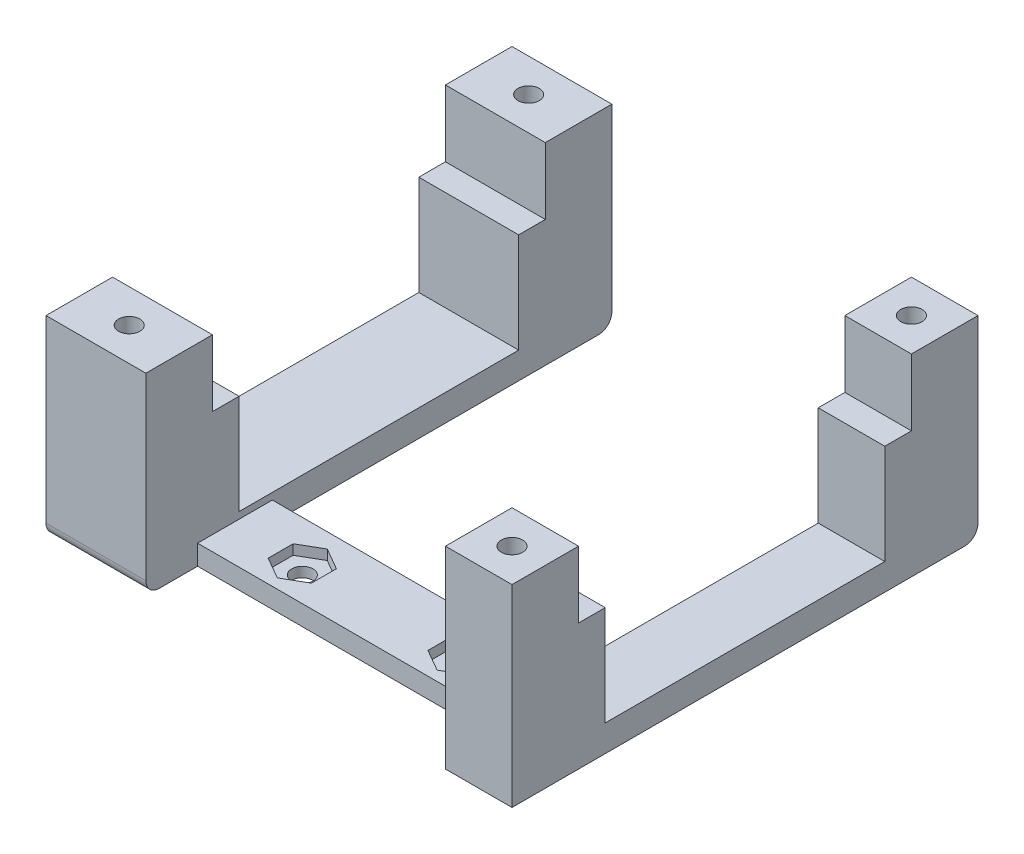
from build123d import *
from build123d.topology import SkipClean

# Parameters (mm, degrees)
CROQUIS1_W                = 15
CROQUIS1_H                = 10
CROQUIS1_R                = 1.6
SALIENTE_EXTRUIR2_DEPTH   = 25
SALIENTE_EXTRUIR2_2_DEPTH = 25
CROQUIS1_W_2              = 10
SALIENTE_EXTRUIR2_3_DEPTH = 25
SALIENTE_EXTRUIR2_4_DEPTH = 25
SALIENTE_EXTRUIR3_START   = 4
CROQUIS2_R                = 1.6
CROQUIS2_W                = 15
CROQUIS2_H                = 10
SALIENTE_EXTRUIR3_DEPTH   = 4
CROQUIS3_W                = 15
CROQUIS3_H                = 4
CROQUIS3_W_2              = 10
SALIENTE_EXTRUIR4_DEPTH   = 15
CROQUIS4_R                = 3.5
CORTAR_EXTRUIR1_DEPTH     = 3.5
SALIENTE_EXTRUIR5_DEPTH   = 3
CROQUIS6_R                = 1.6
CORTAR_EXTRUIR2_DEPTH     = 3
CORTAR_EXTRUIR3_DEPTH     = 1.5
REDONDEO1_R               = 2


with BuildPart() as part:
    # Croquis1 → Saliente-Extruir2 (new body)
    with BuildSketch(Plane(origin=(0, 0, 0), x_dir=(1, 0, 0), z_dir=(0, 1, 0))):
        with Locations((-17.954545455, 17.15034965)):
            Rectangle(CROQUIS1_W, CROQUIS1_H)
        with Locations(Location((-17.954545455, 17.15034965, 0), (0, 0, 270))):
            Circle(CROQUIS1_R, mode=Mode.SUBTRACT)
    extrude(amount=SALIENTE_EXTRUIR2_DEPTH)



with BuildPart() as body_2:
    # Croquis1 → Saliente-Extruir2 2 (new body)
    with BuildSketch(Plane(origin=(0, 0, 0), x_dir=(1, 0, 0), z_dir=(0, 1, 0))):
        with Locations((-17.954545455, -42.84965035)):
            Rectangle(CROQUIS1_W, CROQUIS1_H)
        with Locations(Location((-17.954545455, -42.84965035, 0), (0, 0, 270))):
            Circle(CROQUIS1_R, mode=Mode.SUBTRACT)
    extrude(amount=SALIENTE_EXTRUIR2_2_DEPTH)


with BuildPart() as body_3:
    # Croquis1 → Saliente-Extruir2 3 (new body)
    with BuildSketch(Plane(origin=(0, 0, 0), x_dir=(1, 0, 0), z_dir=(0, 1, 0))):
        with Locations((39.545454545, -42.84965035)):
            Rectangle(CROQUIS1_W_2, CROQUIS1_H)
        with Locations(Location((39.545454545, -42.84965035, 0), (0, 0, 270))):
            Circle(CROQUIS1_R, mode=Mode.SUBTRACT)
    extrude(amount=SALIENTE_EXTRUIR2_3_DEPTH)


with BuildPart() as body_4:
    # Croquis1 → Saliente-Extruir2 4 (new body)
    with BuildSketch(Plane(origin=(0, 0, 0), x_dir=(1, 0, 0), z_dir=(0, 1, 0))):
        with Locations((39.545454545, 17.15034965)):
            Rectangle(CROQUIS1_W_2, CROQUIS1_H)
        with Locations(Location((39.545454545, 17.15034965, 0), (0, 0, 270))):
            Circle(CROQUIS1_R, mode=Mode.SUBTRACT)
    extrude(amount=SALIENTE_EXTRUIR2_4_DEPTH)


with BuildPart() as part_1:
    with SkipClean():  # the faces are left unmerged after this step: merging them gives an invalid solid
        add(part.part)

        add(body_2.part)  # Saliente-Extruir3 merges body 2

        add(body_3.part)  # Saliente-Extruir3 merges body 3

        add(body_4.part)  # Saliente-Extruir3 merges body 4
        # Croquis2 → Saliente-Extruir3 (add)
        # profile 1 of 3: a face of its own
        with BuildSketch(Plane.XZ.offset(SALIENTE_EXTRUIR3_START)):
            Polygon((-25.454545455, -22.15034965), (-10.454545455, -22.15034965), (-10.454545455, -12.15034965), (-10.454545455, 37.84965035), (-25.454545455, 37.84965035), (-25.454545455, -12.15034965), align=None)
            with Locations(Location((-17.954545455, -17.15034965, 0), (0, 0, 270))):
                Circle(CROQUIS2_R, mode=Mode.SUBTRACT)
        # profile 2 of 3: a face of its own
        with BuildSketch(Plane.XZ.offset(SALIENTE_EXTRUIR3_START)):
            with Locations((-17.954545455, 42.84965035)):
                Rectangle(CROQUIS2_W, CROQUIS2_H)
            with Locations(Location((-17.954545455, 42.84965035, 0), (0, 0, 90))):
                Circle(CROQUIS2_R, mode=Mode.SUBTRACT)
        # profile 3 of 3: a face of its own
        with BuildSketch(Plane.XZ.offset(SALIENTE_EXTRUIR3_START)):
            Polygon((34.545454545, -12.15034965), (34.545454545, -22.15034965), (44.545454545, -22.15034965), (44.545454545, -12.15034965), (44.545454545, 37.84965035), (44.545454545, 47.84965035), (34.545454545, 47.84965035), (34.545454545, 37.84965035), align=None)
            with Locations(Location((39.545454545, -17.15034965, 0), (0, 0, 90))):
                Circle(CROQUIS2_R, mode=Mode.SUBTRACT)
            with Locations(Location((39.545454545, 42.84965035, 0), (0, 0, 270))):
                Circle(CROQUIS2_R, mode=Mode.SUBTRACT)
        extrude(amount=-SALIENTE_EXTRUIR3_DEPTH)

    # Croquis3 → Saliente-Extruir4 (add)
    with BuildSketch(Plane(origin=(0, 0, 0), x_dir=(1, 0, 0), z_dir=(0, 1, 0))):
        with Locations((-17.954545455, -35.84965035)):
            Rectangle(CROQUIS3_W, CROQUIS3_H)
        with Locations((-17.954545455, 10.15034965)):
            Rectangle(CROQUIS3_W, CROQUIS3_H)
        with Locations((39.545454545, 10.15034965)):
            Rectangle(CROQUIS3_W_2, CROQUIS3_H)
        with Locations((39.545454545, -35.84965035)):
            Rectangle(CROQUIS3_W_2, CROQUIS3_H)
    extrude(amount=SALIENTE_EXTRUIR4_DEPTH)

    # Croquis4 → Cortar-Extruir1 (cut)
    with SkipClean():  # the faces are left unmerged after this step: merging them gives an invalid solid
        with BuildSketch(Plane.XZ.offset(4)):
            with Locations(Location((39.545454545, 42.84965035, 0), (0, 0, 270))):
                Circle(CROQUIS4_R)
            with Locations(Location((39.545454545, -17.15034965, 0), (0, 0, 270))):
                Circle(CROQUIS4_R)
            with Locations(Location((-17.954545455, -17.15034965, 0), (0, 0, 270))):
                Circle(CROQUIS4_R)
            with Locations(Location((-17.954545455, 42.84965035, 0), (0, 0, 270))):
                Circle(CROQUIS4_R)
        extrude(amount=-CORTAR_EXTRUIR1_DEPTH, mode=Mode.SUBTRACT)

    # Croquis5 → Saliente-Extruir5 (add)
    with SkipClean():  # the faces are left unmerged after this step: merging them gives an invalid solid
        with BuildSketch(Plane.XZ.offset(4)):
            Polygon((-10.454545455, 40.07981816), (34.545454545, 40.07981816), (34.545454545, 35.84965035), (34.545454545, 28.84965035), (-10.454545455, 28.84965035), (-10.454545455, 35.84965035), align=None)
        extrude(amount=-SALIENTE_EXTRUIR5_DEPTH)

    # Croquis6 → Cortar-Extruir2 (cut)
    with SkipClean():  # the faces are left unmerged after this step: merging them gives an invalid solid
        with BuildSketch(Plane.XZ.offset(4)):
            with Locations(Location((24.045454545, 34.84965035, 0), (0, 0, 270))):
                Circle(CROQUIS6_R)
            with Locations(Location((0.045454545, 34.84965035, 0), (0, 0, 270))):
                Circle(CROQUIS6_R)
        extrude(amount=-CORTAR_EXTRUIR2_DEPTH, mode=Mode.SUBTRACT)

    # Croquis7 → Cortar-Extruir3 (cut)
    with SkipClean():  # the faces are left unmerged after this step: merging them gives an invalid solid
        with BuildSketch(Plane(origin=(0, -1, 0), x_dir=(1, 0, 0), z_dir=(0, 1, 0))):
            Polygon((0.045454545, -31.0968736), (-3.204545455, -32.973261975), (-3.204545455, -36.726038725), (0.045454545, -38.602427099), (3.295454545, -36.726038725), (3.295454545, -32.973261975), align=None)
            Polygon((24.045454545, -31.0968736), (20.795454545, -32.973261975), (20.795454545, -36.726038725), (24.045454545, -38.602427099), (27.295454545, -36.726038725), (27.295454545, -32.973261975), align=None)
        extrude(amount=-CORTAR_EXTRUIR3_DEPTH, mode=Mode.SUBTRACT)

    # Redondeo1
    # the kernel refuses this fillet: 2 mm, written as the material it takes off along each edge
    with BuildSketch(Plane(origin=(-5.454545455, -4, 47.84965035), x_dir=(0, 0, -1), z_dir=(-1, 0, 0)), Plane(origin=(-30.454545455, -4, -22.15034965), x_dir=(0, 0, 1), z_dir=(1, 0, 0))) as redondeo1_piece_1:
        with BuildLine():
            CenterArc((REDONDEO1_R, -REDONDEO1_R), REDONDEO1_R, 90, 90)
            Line((0, -REDONDEO1_R), (0, 0))
            Line((0, 0), (REDONDEO1_R, 0))
        make_face()
    extrude(amount=25, mode=Mode.SUBTRACT)
    with BuildSketch(Plane(origin=(29.545454545, -4, -22.15034965), x_dir=(0, 1, 0), z_dir=(1, 0, 0))) as redondeo1_piece_2:
        with BuildLine():
            CenterArc((REDONDEO1_R, REDONDEO1_R), REDONDEO1_R, 180, 90)
            Line((0, REDONDEO1_R), (0, 0))
            Line((0, 0), (REDONDEO1_R, 0))
        make_face()
    extrude(amount=20, mode=Mode.SUBTRACT)


solid = part_1.part
